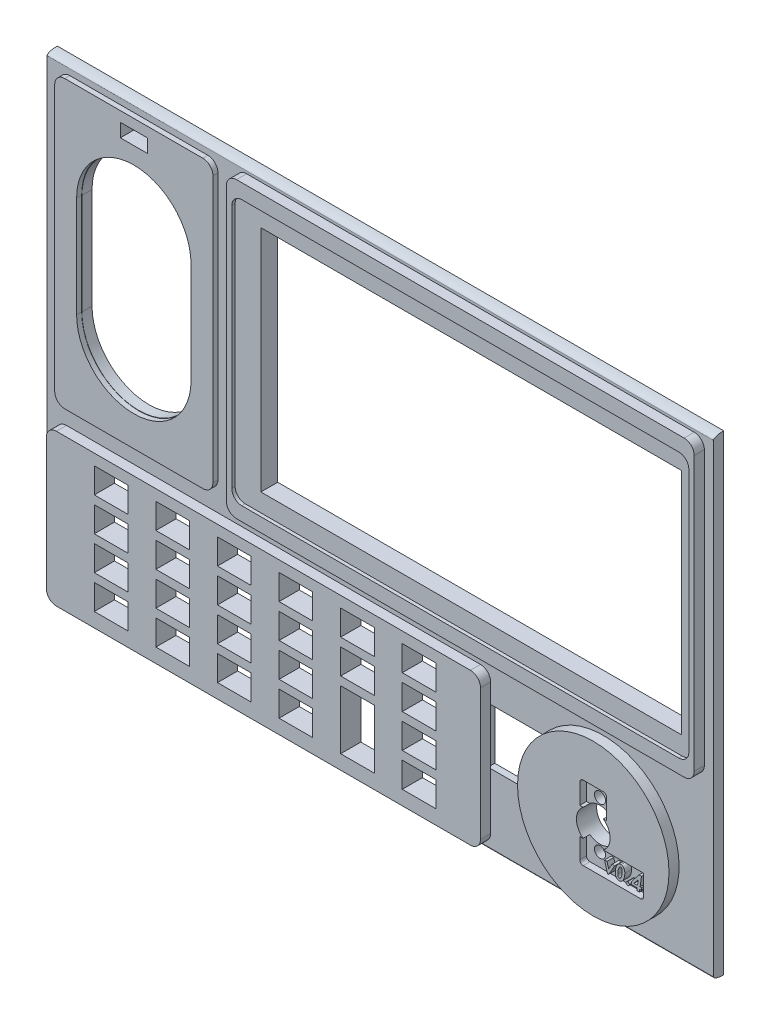
from build123d import *

# Parameters (mm, degrees)
SKETCH1_W                   = 198
SKETCH1_H                   = 140
MAIN_BODY_DEPTH             = 3
LONG_CORNERS_SIZE           = 3
LONG_CORNERS_SIZE_2         = 1
SKETCH2_W                   = 47
SKETCH2_H                   = 85
SPEAKER_DEPTH               = 1.5
SPEAKER_CORNERS_R           = 3
SPEAKER_CUT_DEPTH           = 122.331158548
SKETCH21_W                  = 43
SKETCH21_H                  = 72
SPEAKER_SLOT_DEPTH          = 3
SKETCH36_W                  = 43
SKETCH36_H                  = 0.5
SKETCH36_W_2                = 5.5
SKETCH36_W_3                = 3.5
SKETCH36_W_4                = 10
SPEAKER_PRINT_SUPPORT_DEPTH = 3
SKETCH3_W                   = 139
SKETCH3_H                   = 87.25
LCD_DEPTH                   = 3
LCD_CORNERS_R               = 3
SKETCH9_W                   = 135.8
SKETCH9_H                   = 78.75
LCD_FRONT_DEPTH             = 1
LCD_FRONT_CORNERS_R         = 3
SKETCH10_W                  = 125
SKETCH10_H                  = 68
LCD_BACK_DEPTH              = 122.396046203
SKETCH4_W                   = 129
SKETCH4_H                   = 45
KEYPAD_DEPTH                = 3
KEYPAD_CORNERS_R            = 3
SKETCH25_W                  = 10
SKETCH25_H                  = 7.5
SKETCH25_H_2                = 17.5
KEYPAD_CUTS_0_8_DEPTH       = 122.396046208
SKETCH5_R                   = 22.5
VFO_DEPTH                   = 3
SKETCH7_R                   = 5
VFO_ENCODER_KNOB_CUT_DEPTH  = 122.396046208
SKETCH37_W                  = 19
SKETCH37_H                  = 7
SKETCH37_W_2                = 8
LOGO_CUT_DEPTH              = 2
LOGO_TXT_VER_DEPTH          = 2
LOGO_CORNERS_R              = 1
ESP32_W                     = 18.5
ESP32_H                     = 16.5
ESP32_CAN_CUT_DEPTH         = 3
SKETCH43_W                  = 16.5
SKETCH43_H                  = 16.5
LORA_CUT_DEPTH              = 2.5
SKETCH44_R                  = 1.65
ENCODER_MOUNT_HOLES_DEPTH   = 122.396046208
SKETCH46_W                  = 6
SKETCH46_H                  = 38
LORA_ANT_DEPTH              = 5.5
SKETCH47_W                  = 27
SKETCH47_H                  = 18.5
ESP32_EX_CUT_DEPTH          = 1
SKETCH48_W                  = 5
SKETCH48_H                  = 1
LORA_ANT_SUPPORT_DEPTH      = 5.5
LORA_ANT_SUPPORT_2_DEPTH    = 5.5
LORA_ANT_SUPPORT_3_DEPTH    = 5.5
LORA_ANT_SUPPORT_4_DEPTH    = 5.5
LORA_ANT_SUPPORT_5_DEPTH    = 5.5
LORA_ANT_SUPPORT_6_DEPTH    = 5.5
LORA_ANT_SUPPORT_7_DEPTH    = 5.5
SKETCH49_W                  = 8
SKETCH49_H                  = 4
AMB_SENSOR_DEPTH            = 122.396046208


with BuildPart() as part:
    # Sketch1 → main_body (new body)
    with BuildSketch(Plane.XY):
        Rectangle(SKETCH1_W, SKETCH1_H)
    extrude(amount=MAIN_BODY_DEPTH)

    # long_corners
    # an asymmetric fillet: 3, 1 mm, written as the material it takes off along each edge
    with BuildSketch(Plane(origin=(-106.5, 70, 3), x_dir=(0, 0, -1), z_dir=(1, 0, 0)), Plane(origin=(106.5, -70, 3), x_dir=(0, 0, -1), z_dir=(-1, 0, 0))) as long_corners_piece_1:
        with BuildLine():
            Bezier((LONG_CORNERS_SIZE, 0), (0, 0), (0, -LONG_CORNERS_SIZE_2), weights=[1, 0.707106781, 1])
            Line((0, -LONG_CORNERS_SIZE_2), (0, 0))
            Line((0, 0), (LONG_CORNERS_SIZE, 0))
        make_face()
    extrude(amount=213, mode=Mode.SUBTRACT)

    # Sketch2 → speaker (add)
    with BuildSketch(Plane.XY.offset(3)):
        with Locations((-71.75, 24.75)):
            Rectangle(SKETCH2_W, SKETCH2_H)
    extrude(amount=SPEAKER_DEPTH)

    # speaker_corners
    speaker_corners_edges = [part.edges().sort_by_distance(p)[0] for p in [
        (-95.25, 67.25, 3.75),
        (-95.25, -17.75, 3.75),
        (-48.25, -17.75, 3.75),
        (-48.25, 67.25, 3.75),
    ]]
    fillet(speaker_corners_edges, radius=SPEAKER_CORNERS_R)

    # Sketch19 → speaker_cut (cut, through all)
    with BuildSketch(Plane.XY.offset(4.5)):
        with BuildLine():
            Line((-88.75, 8.25), (-88.75, 38.25))
            ThreePointArc((-88.75, 38.25), (-71.75, 55.25), (-54.75, 38.25))
            Line((-54.75, 38.25), (-54.75, 8.25))
            ThreePointArc((-54.75, 8.25), (-71.75, -8.75), (-88.75, 8.25))
        make_face()
    extrude(amount=-SPEAKER_CUT_DEPTH, mode=Mode.SUBTRACT)

    # Sketch21 → speaker_slot (cut)
    with BuildSketch(Plane(origin=(0, 0, 0), x_dir=(-1, 0, 0), z_dir=(0, 0, -1))):
        with Locations((71.75, 23.25)):
            Rectangle(SKETCH21_W, SKETCH21_H)
    extrude(amount=-SPEAKER_SLOT_DEPTH, mode=Mode.SUBTRACT)

    # Sketch36 → speaker_print_support (add)
    # profile 1 of 17: a face of its own
    with BuildSketch(Plane(origin=(0, 0, 3), x_dir=(-1, 0, 0), z_dir=(0, 0, -1))):
        with BuildLine():
            Line((54.25, 8.263862744), (54.25, 38.236137256))
            ThreePointArc((54.25, 38.236137256), (71.75, 55.736137256), (89.25, 38.236137256))
            Line((89.25, 38.236137256), (89.25, 8.263862744))
            ThreePointArc((89.25, 8.263862744), (71.75, -9.236137256), (54.25, 8.263862744))
        make_face()
        with BuildLine():
            Line((54.831583339, 8.263862744), (54.831583339, 38.236137256))
            ThreePointArc((54.831583339, 38.236137256), (71.75, 55.154553916), (88.668416661, 38.236137256))
            Line((88.668416661, 38.236137256), (88.668416661, 8.263862744))
            ThreePointArc((88.668416661, 8.263862744), (71.75, -8.654553916), (54.831583339, 8.263862744))
        make_face(mode=Mode.SUBTRACT)
    # profile 2 of 17: a face of its own
    with BuildSketch(Plane(origin=(0, 0, 3), x_dir=(-1, 0, 0), z_dir=(0, 0, -1))):
        with Locations((71.75, 57)):
            Rectangle(SKETCH36_W, SKETCH36_H)
    # profile 3 of 17: a face of its own
    with BuildSketch(Plane(origin=(0, 0, 3), x_dir=(-1, 0, 0), z_dir=(0, 0, -1))):
        with Locations((90.5, 0)):
            Rectangle(SKETCH36_W_2, SKETCH36_H)
    # profile 4 of 17: a face of its own
    with BuildSketch(Plane(origin=(0, 0, 3), x_dir=(-1, 0, 0), z_dir=(0, 0, -1))):
        with Locations((71.75, -10.5)):
            Rectangle(SKETCH36_W, SKETCH36_H)
    # profile 5 of 17: a face of its own
    with BuildSketch(Plane(origin=(0, 0, 3), x_dir=(-1, 0, 0), z_dir=(0, 0, -1))):
        with Locations((90.5, 46.5)):
            Rectangle(SKETCH36_W_2, SKETCH36_H)
    # profile 6 of 17: a face of its own
    with BuildSketch(Plane(origin=(0, 0, 3), x_dir=(-1, 0, 0), z_dir=(0, 0, -1))):
        with Locations((91.5, 35)):
            Rectangle(SKETCH36_W_3, SKETCH36_H)
    # profile 7 of 17: a face of its own
    with BuildSketch(Plane(origin=(0, 0, 3), x_dir=(-1, 0, 0), z_dir=(0, 0, -1))):
        with Locations((91.5, 23.5)):
            Rectangle(SKETCH36_W_3, SKETCH36_H)
    # profile 8 of 17: a face of its own
    with BuildSketch(Plane(origin=(0, 0, 3), x_dir=(-1, 0, 0), z_dir=(0, 0, -1))):
        with Locations((91.5, 11)):
            Rectangle(SKETCH36_W_3, SKETCH36_H)
    # profile 9 of 17: a face of its own
    with BuildSketch(Plane(origin=(0, 0, 3), x_dir=(-1, 0, 0), z_dir=(0, 0, -1))):
        with Locations((88.25, -5.5)):
            Rectangle(SKETCH36_W_4, SKETCH36_H)
    # profile 10 of 17: a face of its own
    with BuildSketch(Plane(origin=(0, 0, 3), x_dir=(-1, 0, 0), z_dir=(0, 0, -1))):
        with Locations((88.25, 52)):
            Rectangle(SKETCH36_W_4, SKETCH36_H)
    # profile 11 of 17: a face of its own
    with BuildSketch(Plane(origin=(0, 0, 3), x_dir=(-1, 0, 0), z_dir=(0, 0, -1))):
        with Locations((55.25, 52)):
            Rectangle(SKETCH36_W_4, SKETCH36_H)
    # profile 12 of 17: a face of its own
    with BuildSketch(Plane(origin=(0, 0, 3), x_dir=(-1, 0, 0), z_dir=(0, 0, -1))):
        with Locations((53, 46.5)):
            Rectangle(SKETCH36_W_2, SKETCH36_H)
    # profile 13 of 17: a face of its own
    with BuildSketch(Plane(origin=(0, 0, 3), x_dir=(-1, 0, 0), z_dir=(0, 0, -1))):
        with Locations((52, 35)):
            Rectangle(SKETCH36_W_3, SKETCH36_H)
    # profile 14 of 17: a face of its own
    with BuildSketch(Plane(origin=(0, 0, 3), x_dir=(-1, 0, 0), z_dir=(0, 0, -1))):
        with Locations((52, 23.5)):
            Rectangle(SKETCH36_W_3, SKETCH36_H)
    # profile 15 of 17: a face of its own
    with BuildSketch(Plane(origin=(0, 0, 3), x_dir=(-1, 0, 0), z_dir=(0, 0, -1))):
        with Locations((52, 10.5)):
            Rectangle(SKETCH36_W_3, SKETCH36_H)
    # profile 16 of 17: a face of its own
    with BuildSketch(Plane(origin=(0, 0, 3), x_dir=(-1, 0, 0), z_dir=(0, 0, -1))):
        with Locations((53, 0)):
            Rectangle(SKETCH36_W_2, SKETCH36_H)
    # profile 17 of 17: a face of its own
    with BuildSketch(Plane(origin=(0, 0, 3), x_dir=(-1, 0, 0), z_dir=(0, 0, -1))):
        with Locations((55.25, -5.5)):
            Rectangle(SKETCH36_W_4, SKETCH36_H)
    extrude(amount=SPEAKER_PRINT_SUPPORT_DEPTH)

    # Sketch3 → lcd (add)
    with BuildSketch(Plane.XY.offset(3)):
        with Locations((26.75, 24.625)):
            Rectangle(SKETCH3_W, SKETCH3_H)
    extrude(amount=LCD_DEPTH)

    # lcd_corners
    lcd_corners_edges = [part.edges().sort_by_distance(p)[0] for p in [
        (-42.75, 68.25, 4.5),
        (-42.75, -19, 4.5),
        (96.25, -19, 4.5),
        (96.25, 68.25, 4.5),
    ]]
    fillet(lcd_corners_edges, radius=LCD_CORNERS_R)

    # Sketch9 → lcd_front (cut)
    with BuildSketch(Plane.XY.offset(6)):
        with Locations((26.75, 24.5)):
            Rectangle(SKETCH9_W, SKETCH9_H)
    extrude(amount=-LCD_FRONT_DEPTH, mode=Mode.SUBTRACT)

    # lcd_front_corners
    lcd_front_corners_edges = [part.edges().sort_by_distance(p)[0] for p in [
        (-41.15, -14.875, 5.5),
        (-41.15, 63.875, 5.5),
        (94.65, 63.875, 5.5),
        (94.65, -14.875, 5.5),
    ]]
    fillet(lcd_front_corners_edges, radius=LCD_FRONT_CORNERS_R)

    # Sketch10 → lcd_back (cut, through all)
    with BuildSketch(Plane(origin=(0, 0, 0), x_dir=(-1, 0, 0), z_dir=(0, 0, -1))):
        with Locations((-29, 24.5)):
            Rectangle(SKETCH10_W, SKETCH10_H)
    extrude(amount=-LCD_BACK_DEPTH, mode=Mode.SUBTRACT)

    # Sketch4 → keypad (add)
    with BuildSketch(Plane.XY.offset(3)):
        with Locations((-31.75, -45.75)):
            Rectangle(SKETCH4_W, SKETCH4_H)
    extrude(amount=KEYPAD_DEPTH)

    # keypad_corners
    keypad_corners_edges = [part.edges().sort_by_distance(p)[0] for p in [
        (-96.25, -23.25, 4.5),
        (-96.25, -68.25, 4.5),
        (32.75, -68.25, 4.5),
        (32.75, -23.25, 4.5),
    ]]
    fillet(keypad_corners_edges, radius=KEYPAD_CORNERS_R)

    # Sketch25 → keypad_cuts_0.8 (cut, through all)
    with BuildSketch(Plane.XY.offset(6)):
        with Locations((-77, -30.25)):
            Rectangle(SKETCH25_W, SKETCH25_H)
        with Locations((-77, -40.25)):
            Rectangle(SKETCH25_W, SKETCH25_H)
        with Locations((-77, -50.25)):
            Rectangle(SKETCH25_W, SKETCH25_H)
        with Locations((-77, -60.25)):
            Rectangle(SKETCH25_W, SKETCH25_H)
        with Locations((-58.7, -30.25)):
            Rectangle(SKETCH25_W, SKETCH25_H)
        with Locations((-58.7, -40.25)):
            Rectangle(SKETCH25_W, SKETCH25_H)
        with Locations((-58.7, -50.25)):
            Rectangle(SKETCH25_W, SKETCH25_H)
        with Locations((-58.7, -60.25)):
            Rectangle(SKETCH25_W, SKETCH25_H)
        with Locations((-40.4, -30.25)):
            Rectangle(SKETCH25_W, SKETCH25_H)
        with Locations((-40.4, -40.25)):
            Rectangle(SKETCH25_W, SKETCH25_H)
        with Locations((-40.4, -50.25)):
            Rectangle(SKETCH25_W, SKETCH25_H)
        with Locations((-40.4, -60.25)):
            Rectangle(SKETCH25_W, SKETCH25_H)
        with Locations((-22.1, -30.25)):
            Rectangle(SKETCH25_W, SKETCH25_H)
        with Locations((-22.1, -40.25)):
            Rectangle(SKETCH25_W, SKETCH25_H)
        with Locations((-22.1, -50.25)):
            Rectangle(SKETCH25_W, SKETCH25_H)
        with Locations((-22.1, -60.25)):
            Rectangle(SKETCH25_W, SKETCH25_H)
        with Locations((-3.8, -30.25)):
            Rectangle(SKETCH25_W, SKETCH25_H)
        with Locations((14.5, -30.25)):
            Rectangle(SKETCH25_W, SKETCH25_H)
        with Locations((-3.8, -40.25)):
            Rectangle(SKETCH25_W, SKETCH25_H)
        with Locations((14.5, -40.25)):
            Rectangle(SKETCH25_W, SKETCH25_H)
        with Locations((14.5, -50.25)):
            Rectangle(SKETCH25_W, SKETCH25_H)
        with Locations((14.5, -60.25)):
            Rectangle(SKETCH25_W, SKETCH25_H)
        with Locations((-3.8, -55.25)):
            Rectangle(SKETCH25_W, SKETCH25_H_2)
    extrude(amount=-KEYPAD_CUTS_0_8_DEPTH, mode=Mode.SUBTRACT)

    # Sketch5 → vfo (add)
    with BuildSketch(Plane.XY.offset(3)):
        with Locations((66.25, -45.75)):
            Circle(SKETCH5_R)
    extrude(amount=VFO_DEPTH)

    # Sketch7 → vfo_encoder_knob_cut (cut, through all)
    with BuildSketch(Plane.XY.offset(6)):
        with Locations((66.25, -45.75)):
            Circle(SKETCH7_R)
    extrude(amount=-VFO_ENCODER_KNOB_CUT_DEPTH, mode=Mode.SUBTRACT)

    # Sketch37 → logo_cut (cut)
    with BuildSketch(Plane.XY.offset(6)):
        with Locations((71.75, -53.25)):
            Rectangle(SKETCH37_W, SKETCH37_H)
        with Locations((66.25, -38.25)):
            Rectangle(SKETCH37_W_2, SKETCH37_H)
    extrude(amount=-LOGO_CUT_DEPTH, mode=Mode.SUBTRACT)

    # Sketch39 → logo_txt_ver (add)
    # profile 1 of 4: a face of its own
    with BuildSketch(Plane.XY.offset(4)):
        Polygon((69.593603098, -52.1228561), (70.325447382, -52.1228561), (70.816452991, -53.843495791), (71.823904915, -52.1228561), (72.632071314, -52.1228561), (70.821541132, -55.216445844), (70.476395566, -55.216445844), align=None)
    # profile 2 of 4: a face of its own
    with BuildSketch(Plane.XY.offset(4)):
        with BuildLine():
            add(Edge.make_bspline(
                [(74.483306624, -50.874565502), (74.52298082, -50.875795528), (74.601170322, -50.87821965), (74.715492643, -50.899653781), (74.825349181, -50.932120481), (74.92921693, -50.980946205), (75.029477781, -51.040750753), (75.122711711, -51.116943912), (75.212332831, -51.204521963), (75.296047107, -51.305539519), (75.372824655, -51.419248323), (75.438649142, -51.546769094), (75.49569148, -51.685939906), (75.540969256, -51.83776318), (75.576664195, -52.001610164), (75.60145224, -52.177923197), (75.616969224, -52.366525273), (75.618744605, -52.496237412), (75.61965812, -52.562980299)],
                knots=[0, 0, 0, 0, 0.836471817, 1.648510141, 2.446693269, 3.247435573, 4.063800371, 4.904091908, 5.781463953, 6.704836402, 7.667709944, 8.670923685, 9.727683881, 10.837250621, 12.009625467, 13.263198326, 14.591789123, 16, 16, 16, 16], degree=3))
            add(Edge.make_bspline(
                [(75.61965812, -52.562980299), (75.618789956, -52.632816793), (75.617076972, -52.770612041), (75.605096765, -52.974626446), (75.584904009, -53.17299239), (75.556211827, -53.365747486), (75.518683541, -53.552428277), (75.473940108, -53.733689305), (75.420453316, -53.909101426), (75.359593818, -54.077949378), (75.293364906, -54.237978695), (75.221962721, -54.387157738), (75.146403231, -54.524126464), (75.06893028, -54.650882727), (74.985482248, -54.764128364), (74.899617931, -54.866890365), (74.810118692, -54.958236021), (74.715135486, -55.036206727), (74.618399212, -55.10398037), (74.520168842, -55.163147091), (74.420182228, -55.213287094), (74.31810111, -55.254294613), (74.214386359, -55.285440783), (74.109326621, -55.308813247), (74.002290106, -55.32272783), (73.930152573, -55.324235706), (73.893930288, -55.324992853)],
                knots=[0, 0, 0, 0, 1.396844559, 2.756131219, 4.086127259, 5.383920942, 6.652453196, 7.89349539, 9.116895717, 10.318757433, 11.482194025, 12.579741648, 13.624829685, 14.610133714, 15.548779577, 16.435605836, 17.287197802, 18.102347136, 18.889788549, 19.648068299, 20.394000194, 21.124756219, 21.84557971, 22.557590164, 23.275725456, 24, 24, 24, 24], degree=3))
            add(Edge.make_bspline(
                [(73.893930288, -55.324992853), (73.843149178, -55.322924604), (73.743631944, -55.318871396), (73.598486378, -55.285253638), (73.461942844, -55.230862228), (73.356167713, -55.167459275), (73.277034517, -55.106688798), (73.220792965, -55.054616575), (73.16575177, -54.99905032), (73.11577994, -54.936249232), (73.068747172, -54.868509996), (73.023164401, -54.796241041), (72.981949214, -54.71810344), (72.943694527, -54.634613014), (72.908425992, -54.545461253), (72.879274748, -54.44916121), (72.85345146, -54.346525614), (72.834063845, -54.236997381), (72.816126012, -54.121516974), (72.806048605, -53.999107415), (72.798956368, -53.870434257), (72.797950069, -53.782449115), (72.797435897, -53.737492853)],
                knots=[0, 0, 0, 0, 1.406247179, 2.755863859, 4.106117258, 5.46602111, 6.158742467, 6.868709005, 7.589063128, 8.324514997, 9.089670002, 9.87455016, 10.69128516, 11.536247762, 12.419471489, 13.346380782, 14.323181077, 15.351303999, 16.428392134, 17.561291642, 18.753934945, 20, 20, 20, 20], degree=3))
            add(Edge.make_bspline(
                [(72.797435897, -53.737492853), (72.798307308, -53.661438712), (72.800028518, -53.511216666), (72.811964663, -53.289128668), (72.832071426, -53.073513255), (72.861158062, -52.864791305), (72.897133299, -52.662605135), (72.942507727, -52.467515455), (72.994355699, -52.278411135), (73.036754183, -52.156281873), (73.057779113, -52.095719348)],
                knots=[0, 0, 0, 0, 1.092573637, 2.158050095, 3.194115651, 4.202596009, 5.184740479, 6.143227219, 7.07924729, 8, 8, 8, 8], degree=3))
            add(Edge.make_bspline(
                [(73.057779113, -52.095719348), (73.077537426, -52.044588755), (73.116173308, -51.944606759), (73.182812761, -51.802210754), (73.252759666, -51.669700483), (73.327413864, -51.548078362), (73.406479988, -51.437046775), (73.490337998, -51.336877263), (73.578946044, -51.247029176), (73.67217263, -51.168382345), (73.768570642, -51.099815011), (73.865727515, -51.038904109), (73.96573894, -50.989012823), (74.066482923, -50.947174616), (74.168613651, -50.914684142), (74.272229962, -50.891943052), (74.377124819, -50.876571566), (74.447918341, -50.875234083), (74.483306624, -50.874565502)],
                knots=[0, 0, 0, 0, 1.312439913, 2.566376662, 3.7626465, 4.899353607, 5.981447343, 7.024199363, 8.024692673, 8.999854102, 9.941079975, 10.856034809, 11.7431154, 12.614348406, 13.466487218, 14.305782657, 15.153094213, 16, 16, 16, 16], degree=3))
        make_face()
        with BuildLine():
            add(Edge.make_bspline(
                [(74.404440438, -51.580121058), (74.376778708, -51.581929582), (74.320887807, -51.585583729), (74.239664339, -51.615644306), (74.161652517, -51.663287994), (74.116194557, -51.706646732), (74.092367788, -51.729373194)],
                knots=[0, 0, 0, 0, 0.932167559, 1.883457255, 2.89061511, 4, 4, 4, 4], degree=3))
            add(Edge.make_bspline(
                [(74.092367788, -51.729373194), (74.074648352, -51.749355338), (74.03734554, -51.791421579), (73.988622227, -51.865349436), (73.938519059, -51.948386496), (73.892783823, -52.044104492), (73.847049082, -52.1502047), (73.801664185, -52.267294971), (73.76032745, -52.396275902), (73.704202078, -52.581971795), (73.645383273, -52.824621628), (73.594485412, -53.123512938), (73.56305768, -53.428137047), (73.559203645, -53.633394549), (73.557264957, -53.736644829)],
                knots=[0, 0, 0, 0, 0.454841493, 0.957528522, 1.506411314, 2.107825232, 2.764136245, 3.476658851, 4.247912131, 5.07291354, 6.784378205, 8.500722671, 10.239765365, 12, 12, 12, 12], degree=3))
            add(Edge.make_bspline(
                [(73.557264957, -53.736644829), (73.557601345, -53.777917397), (73.558246753, -53.857104665), (73.562797234, -53.970602004), (73.572723703, -54.073751147), (73.58360441, -54.166784338), (73.599681824, -54.24923044), (73.619208766, -54.321233266), (73.641333582, -54.383256201), (73.668264815, -54.435457592), (73.698096775, -54.479199696), (73.731243169, -54.516371399), (73.766094212, -54.548536662), (73.804514421, -54.574472182), (73.84478695, -54.595165812), (73.888565479, -54.608248033), (73.934154819, -54.618577069), (73.965948672, -54.619147217), (73.982124733, -54.619437297)],
                knots=[0, 0, 0, 0, 1.809169144, 3.47114723, 4.976568932, 6.350508084, 7.575216927, 8.654321082, 9.618705548, 10.455493865, 11.22189838, 11.932917759, 12.63470061, 13.29454068, 13.959479695, 14.609946561, 15.292769288, 16, 16, 16, 16], degree=3))
            add(Edge.make_bspline(
                [(73.982124733, -54.619437297), (74.012692304, -54.617003318), (74.07608428, -54.611955657), (74.169989406, -54.572799356), (74.263226826, -54.510978012), (74.340457582, -54.442723851), (74.402399265, -54.374102607), (74.447576899, -54.307929108), (74.492488631, -54.230956457), (74.537550245, -54.143276893), (74.579293974, -54.042951999), (74.621885377, -53.931968516), (74.663183308, -53.80918437), (74.716607233, -53.628734273), (74.775431522, -53.389278435), (74.823607381, -53.088086267), (74.854093568, -52.773919376), (74.85789457, -52.559942837), (74.85982906, -52.451041197)],
                knots=[0, 0, 0, 0, 0.585084729, 1.213366824, 1.923217654, 2.726038827, 3.183054462, 3.692969635, 4.259263019, 4.892137045, 5.581993971, 6.3422359, 7.172083011, 8.065836625, 9.951587279, 11.896519821, 13.911566738, 16, 16, 16, 16], degree=3))
            add(Edge.make_bspline(
                [(74.85982906, -52.451041197), (74.859573711, -52.413439706), (74.859079941, -52.340729341), (74.853354196, -52.235989355), (74.84279836, -52.139589901), (74.830319363, -52.051209867), (74.810833655, -51.971703464), (74.790737732, -51.899612323), (74.764122185, -51.836785699), (74.73432591, -51.781608182), (74.701044134, -51.73430589), (74.666414836, -51.692771673), (74.62827255, -51.658652), (74.588704551, -51.629335674), (74.545792755, -51.606961659), (74.500481608, -51.59195471), (74.453195181, -51.582124112), (74.420885169, -51.580796678), (74.404440438, -51.580121058)],
                knots=[0, 0, 0, 0, 1.651300251, 3.193135231, 4.60384893, 5.910135154, 7.108621979, 8.196635245, 9.19265296, 10.098222774, 10.945408105, 11.729089381, 12.467301952, 13.187443458, 13.887068836, 14.581941946, 15.278255209, 16, 16, 16, 16], degree=3))
        make_face(mode=Mode.SUBTRACT)
    # profile 3 of 4: a face of its own
    with BuildSketch(Plane.XY.offset(4)):
        with BuildLine():
            add(Edge.make_bspline(
                [(76.488034188, -54.293796271), (76.52047559, -54.295195466), (76.58430585, -54.29794846), (76.675592646, -54.326730368), (76.760117021, -54.371537446), (76.83407679, -54.4342546), (76.897155306, -54.508334033), (76.943987182, -54.592201885), (76.971114608, -54.685079112), (76.974670268, -54.749291486), (76.976495726, -54.78225781)],
                knots=[0, 0, 0, 0, 1.011829643, 1.990831015, 2.96394547, 3.98733706, 5.003945692, 5.993273531, 6.969756284, 8, 8, 8, 8], degree=3))
            add(Edge.make_bspline(
                [(76.976495726, -54.78225781), (76.974620199, -54.814649503), (76.970936111, -54.878276297), (76.94403317, -54.970657997), (76.896878441, -55.054519863), (76.834434584, -55.129490294), (76.759809835, -55.191830672), (76.676017962, -55.238284814), (76.584064164, -55.265180699), (76.520429757, -55.268850893), (76.488034188, -55.270719348)],
                knots=[0, 0, 0, 0, 1.013694729, 1.991193998, 2.981551723, 4.006008661, 5.030465598, 6.008806002, 6.986305271, 8, 8, 8, 8], degree=3))
            add(Edge.make_bspline(
                [(76.488034188, -55.270719348), (76.455362973, -55.268839785), (76.391187038, -55.265147766), (76.298568031, -55.238486954), (76.214598936, -55.191782119), (76.139951116, -55.129733725), (76.078255891, -55.054464116), (76.032178185, -54.97043986), (76.005085163, -54.878298836), (76.001432288, -54.814657107), (75.99957265, -54.78225781)],
                knots=[0, 0, 0, 0, 1.02155614, 2.006638561, 2.984070978, 4.007577129, 5.025452526, 6.010654007, 6.987246069, 8, 8, 8, 8], degree=3))
            add(Edge.make_bspline(
                [(75.99957265, -54.78225781), (76.001381788, -54.749283713), (76.004905659, -54.685056198), (76.032224273, -54.592419638), (76.07798063, -54.508393961), (76.14030968, -54.434008005), (76.214292162, -54.371587534), (76.298992626, -54.326528348), (76.390946483, -54.297979543), (76.455317207, -54.295205966), (76.488034188, -54.293796271)],
                knots=[0, 0, 0, 0, 1.029295292, 2.004879113, 2.989063463, 3.999073543, 5.021523017, 5.993741641, 6.980301721, 8, 8, 8, 8], degree=3))
        make_face()
    # profile 4 of 4: a face of its own
    with BuildSketch(Plane.XY.offset(4)):
        Polygon((79.829246795, -50.874565502), (80.56617922, -50.874565502), (80.16930422, -53.751061229), (80.583987714, -53.751061229), (80.492401175, -54.456616784), (80.072629541, -54.456616784), (79.967474626, -55.216445844), (79.201709402, -55.216445844), (79.306864316, -54.456616784), (77.519230769, -54.456616784), (77.573504274, -53.72222843), align=None)
        Polygon((79.62232906, -52.165257276), (78.36640625, -53.751061229), (79.403538996, -53.751061229), align=None, mode=Mode.SUBTRACT)
    extrude(amount=LOGO_TXT_VER_DEPTH)

    # logo_corners
    logo_corners_edges = [part.edges().sort_by_distance(p)[0] for p in [
        (62.25, -56.75, 5),
        (81.25, -56.75, 5),
        (62.25, -34.75, 5),
        (70.25, -34.75, 5),
    ]]
    fillet(logo_corners_edges, radius=LOGO_CORNERS_R)

    # esp32 → esp32_can_cut (cut)
    with BuildSketch(Plane(origin=(0, 0, 0), x_dir=(-1, 0, 0), z_dir=(0, 0, -1))):
        with Locations((-41.25, -40.3)):
            Rectangle(ESP32_W, ESP32_H)
    extrude(amount=-ESP32_CAN_CUT_DEPTH, mode=Mode.SUBTRACT)

    # Sketch43 → lora_cut (cut)
    with BuildSketch(Plane(origin=(0, 0, 0), x_dir=(-1, 0, 0), z_dir=(0, 0, -1))):
        with Locations((-42.25, -58.75)):
            Rectangle(SKETCH43_W, SKETCH43_H)
    extrude(amount=-LORA_CUT_DEPTH, mode=Mode.SUBTRACT)

    # Sketch44 → encoder_mount_holes (cut, through all)
    with BuildSketch(Plane.XY.offset(6)):
        with Locations((66.25, -38.75)):
            Circle(SKETCH44_R)
        with Locations((66.25, -52.75)):
            Circle(SKETCH44_R)
    extrude(amount=-ENCODER_MOUNT_HOLES_DEPTH, mode=Mode.SUBTRACT)

    # Sketch46 → lora_ant (cut)
    with BuildSketch(Plane(origin=(0, 0, 0), x_dir=(-1, 0, 0), z_dir=(0, 0, -1))):
        with Locations((-25, -45.5)):
            Rectangle(SKETCH46_W, SKETCH46_H)
    extrude(amount=-LORA_ANT_DEPTH, mode=Mode.SUBTRACT)

    # Sketch47 → esp32_ex_cut (cut)
    with BuildSketch(Plane(origin=(0, 0, 0), x_dir=(-1, 0, 0), z_dir=(0, 0, -1))):
        with Locations((-44.5, -40.3)):
            Rectangle(SKETCH47_W, SKETCH47_H)
    extrude(amount=-ESP32_EX_CUT_DEPTH, mode=Mode.SUBTRACT)

    # Sketch49 → amb_sensor (cut, through all)
    with BuildSketch(Plane(origin=(0, 0, 0), x_dir=(-1, 0, 0), z_dir=(0, 0, -1))):
        with Locations((71.75, 62.25)):
            Rectangle(SKETCH49_W, SKETCH49_H)
    extrude(amount=-AMB_SENSOR_DEPTH, mode=Mode.SUBTRACT)


with BuildPart() as body_2:
    # Sketch48 → lora_ant_support (new body)
    with BuildSketch(Plane(origin=(0, 0, 0), x_dir=(-1, 0, 0), z_dir=(0, 0, -1))):
        with Locations((-25, -30)):
            Rectangle(SKETCH48_W, SKETCH48_H)
    extrude(amount=-LORA_ANT_SUPPORT_DEPTH)


with BuildPart() as body_3:
    # Sketch48 → lora_ant_support 2 (new body)
    with BuildSketch(Plane(origin=(0, 0, 0), x_dir=(-1, 0, 0), z_dir=(0, 0, -1))):
        with Locations((-25, -35)):
            Rectangle(SKETCH48_W, SKETCH48_H)
    extrude(amount=-LORA_ANT_SUPPORT_2_DEPTH)


with BuildPart() as body_4:
    # Sketch48 → lora_ant_support 3 (new body)
    with BuildSketch(Plane(origin=(0, 0, 0), x_dir=(-1, 0, 0), z_dir=(0, 0, -1))):
        with Locations((-25, -40)):
            Rectangle(SKETCH48_W, SKETCH48_H)
    extrude(amount=-LORA_ANT_SUPPORT_3_DEPTH)


with BuildPart() as body_5:
    # Sketch48 → lora_ant_support 4 (new body)
    with BuildSketch(Plane(origin=(0, 0, 0), x_dir=(-1, 0, 0), z_dir=(0, 0, -1))):
        with Locations((-25, -45)):
            Rectangle(SKETCH48_W, SKETCH48_H)
    extrude(amount=-LORA_ANT_SUPPORT_4_DEPTH)


with BuildPart() as body_6:
    # Sketch48 → lora_ant_support 5 (new body)
    with BuildSketch(Plane(origin=(0, 0, 0), x_dir=(-1, 0, 0), z_dir=(0, 0, -1))):
        with Locations((-25, -50)):
            Rectangle(SKETCH48_W, SKETCH48_H)
    extrude(amount=-LORA_ANT_SUPPORT_5_DEPTH)


with BuildPart() as body_7:
    # Sketch48 → lora_ant_support 6 (new body)
    with BuildSketch(Plane(origin=(0, 0, 0), x_dir=(-1, 0, 0), z_dir=(0, 0, -1))):
        with Locations((-25, -55)):
            Rectangle(SKETCH48_W, SKETCH48_H)
    extrude(amount=-LORA_ANT_SUPPORT_6_DEPTH)


with BuildPart() as body_8:
    # Sketch48 → lora_ant_support 7 (new body)
    with BuildSketch(Plane(origin=(0, 0, 0), x_dir=(-1, 0, 0), z_dir=(0, 0, -1))):
        with Locations((-25, -60)):
            Rectangle(SKETCH48_W, SKETCH48_H)
    extrude(amount=-LORA_ANT_SUPPORT_7_DEPTH)


solid = Compound([part.part, body_2.part, body_3.part, body_4.part, body_5.part, body_6.part, body_7.part, body_8.part])
